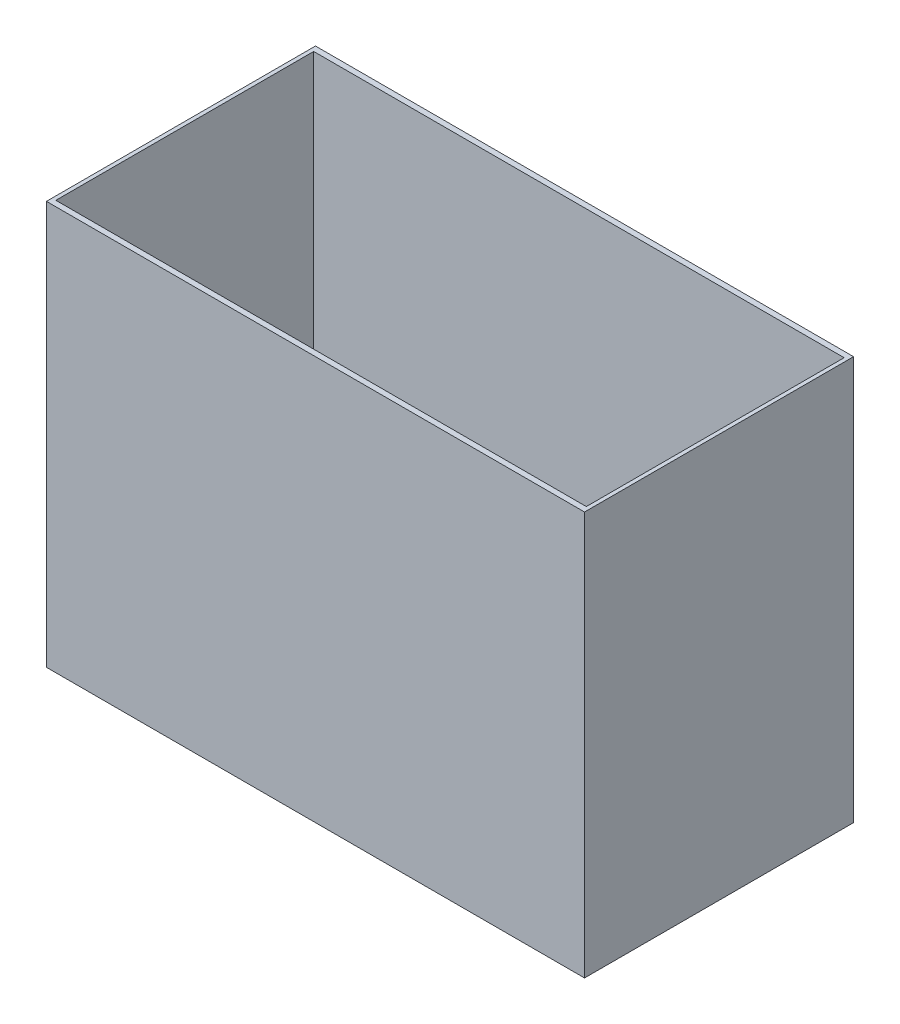
from build123d import *

# Parameters (mm, degrees)
SKETCH1_W           = 584.2
SKETCH1_H           = 279.4
BOSS_EXTRUDE1_DEPTH = 6.35
SKETCH3_W           = 609.6
SKETCH3_H           = 304.8
SKETCH3_W_2         = 600.964
SKETCH3_H_2         = 292.1
BOSS_EXTRUDE3_DEPTH = 457.2
SKETCH4_R           = 21.038100037
CUT_EXTRUDE1_DEPTH  = 566.15
SKETCH11_W          = 50.8
SKETCH11_H          = 3.175
CUT_EXTRUDE6_DEPTH  = 571.228585744
SKETCH12_W          = 6.35
SKETCH12_H          = 25.4
CUT_EXTRUDE7_DEPTH  = 566.15
SKETCH13_R          = 21.038100037
CUT_EXTRUDE8_DEPTH  = 566.15
SKETCH14_R          = 2.778125
CUT_EXTRUDE9_DEPTH  = 566.15
SKETCH15_W          = 6.604
SKETCH15_H          = 19.304
SKETCH15_H_2        = 25.654
CUT_EXTRUDE10_DEPTH = 571.228585744
SKETCH16_W          = 25.4
SKETCH16_H          = 12.7
CUT_EXTRUDE11_DEPTH = 571.228585744


with BuildPart() as part:
    # Sketch1 → Boss-Extrude1 (new body)
    with BuildSketch(Plane(origin=(0, 0, 0), x_dir=(1, 0, 0), z_dir=(0, 1, 0))):
        Rectangle(SKETCH1_W, SKETCH1_H)
    extrude(amount=BOSS_EXTRUDE1_DEPTH)

    # Sketch4 → Cut-Extrude1 (cut, through all)
    with BuildSketch(Plane(origin=(0, 6.35, 0), x_dir=(1, 0, 0), z_dir=(0, 1, 0))):
        with Locations((252.011899963, 99.611899963)):
            Circle(SKETCH4_R)
    cut_extrude1 = extrude(amount=-CUT_EXTRUDE1_DEPTH, mode=Mode.SUBTRACT)

    # Sketch11 → Cut-Extrude6 (cut, through all)
    with BuildSketch(Plane.XZ):
        with Locations((190.5, 138.1125)):
            Rectangle(SKETCH11_W, SKETCH11_H)
    cut_extrude6 = extrude(amount=-CUT_EXTRUDE6_DEPTH, mode=Mode.SUBTRACT)

    # Mirror2: Cut-Extrude1, Cut-Extrude6 across plane
    add(cut_extrude1.mirror(Plane.XY), mode=Mode.SUBTRACT)
    add(cut_extrude6.mirror(Plane.XY), mode=Mode.SUBTRACT)

    # Sketch12 → Cut-Extrude7 (cut, through all)
    with BuildSketch(Plane(origin=(0, 6.35, 0), x_dir=(1, 0, 0), z_dir=(0, 1, 0))):
        with Locations((288.925, -30.48)):
            Rectangle(SKETCH12_W, SKETCH12_H)
        with Locations((288.925, -91.44)):
            Rectangle(SKETCH12_W, SKETCH12_H)
        with Locations((288.925, 91.44)):
            Rectangle(SKETCH12_W, SKETCH12_H)
        with Locations((288.925, 30.48)):
            Rectangle(SKETCH12_W, SKETCH12_H)
        with Locations((-288.925, 91.44)):
            Rectangle(SKETCH12_W, SKETCH12_H)
        with Locations((-288.925, 30.48)):
            Rectangle(SKETCH12_W, SKETCH12_H)
        with Locations((-288.925, -30.48)):
            Rectangle(SKETCH12_W, SKETCH12_H)
        with Locations((-288.925, -91.44)):
            Rectangle(SKETCH12_W, SKETCH12_H)
    extrude(amount=-CUT_EXTRUDE7_DEPTH, mode=Mode.SUBTRACT)

    # Sketch13 → Cut-Extrude8 (cut, through all)
    with BuildSketch(Plane(origin=(0, 6.35, 0), x_dir=(1, 0, 0), z_dir=(0, 1, 0))):
        with Locations((133.500264321, -46.186585501)):
            Circle(SKETCH13_R)
        with Locations((210.617612829, 12.193993268)):
            Circle(SKETCH13_R)
    extrude(amount=-CUT_EXTRUDE8_DEPTH, mode=Mode.SUBTRACT)

    # Sketch14 → Cut-Extrude9 (cut, through all)
    with BuildSketch(Plane(origin=(0, 6.35, 0), x_dir=(1, 0, 0), z_dir=(0, 1, 0))):
        with Locations((45.303543088, 4.218995635)):
            Circle(SKETCH14_R)
    extrude(amount=-CUT_EXTRUDE9_DEPTH, mode=Mode.SUBTRACT)

    # Sketch15 → Cut-Extrude10 (cut, through all)
    with BuildSketch(Plane.XZ):
        with Locations((92.075, -47.625)):
            Rectangle(SKETCH15_W, SKETCH15_H)
        with Locations((92.075, 44.45)):
            Rectangle(SKETCH15_W, SKETCH15_H_2)
    extrude(amount=-CUT_EXTRUDE10_DEPTH, mode=Mode.SUBTRACT)

    # Sketch16 → Cut-Extrude11 (cut, through all)
    with BuildSketch(Plane.XZ):
        with Locations((-50.8, -60.325)):
            Rectangle(SKETCH16_W, SKETCH16_H)
        with Locations((-228.6, -60.325)):
            Rectangle(SKETCH16_W, SKETCH16_H)
        with Locations((-228.6, 60.325)):
            Rectangle(SKETCH16_W, SKETCH16_H)
        with Locations((-50.8, 60.325)):
            Rectangle(SKETCH16_W, SKETCH16_H)
    extrude(amount=-CUT_EXTRUDE11_DEPTH, mode=Mode.SUBTRACT)


with BuildPart() as body_2:
    # Sketch3 → Boss-Extrude3 (new body)
    with BuildSketch(Plane(origin=(0, 0, 0), x_dir=(1, 0, 0), z_dir=(0, 1, 0))):
        Rectangle(SKETCH3_W, SKETCH3_H)
        Rectangle(SKETCH3_W_2, SKETCH3_H_2, mode=Mode.SUBTRACT)
    extrude(amount=BOSS_EXTRUDE3_DEPTH)


solid = Compound([part.part, body_2.part])
